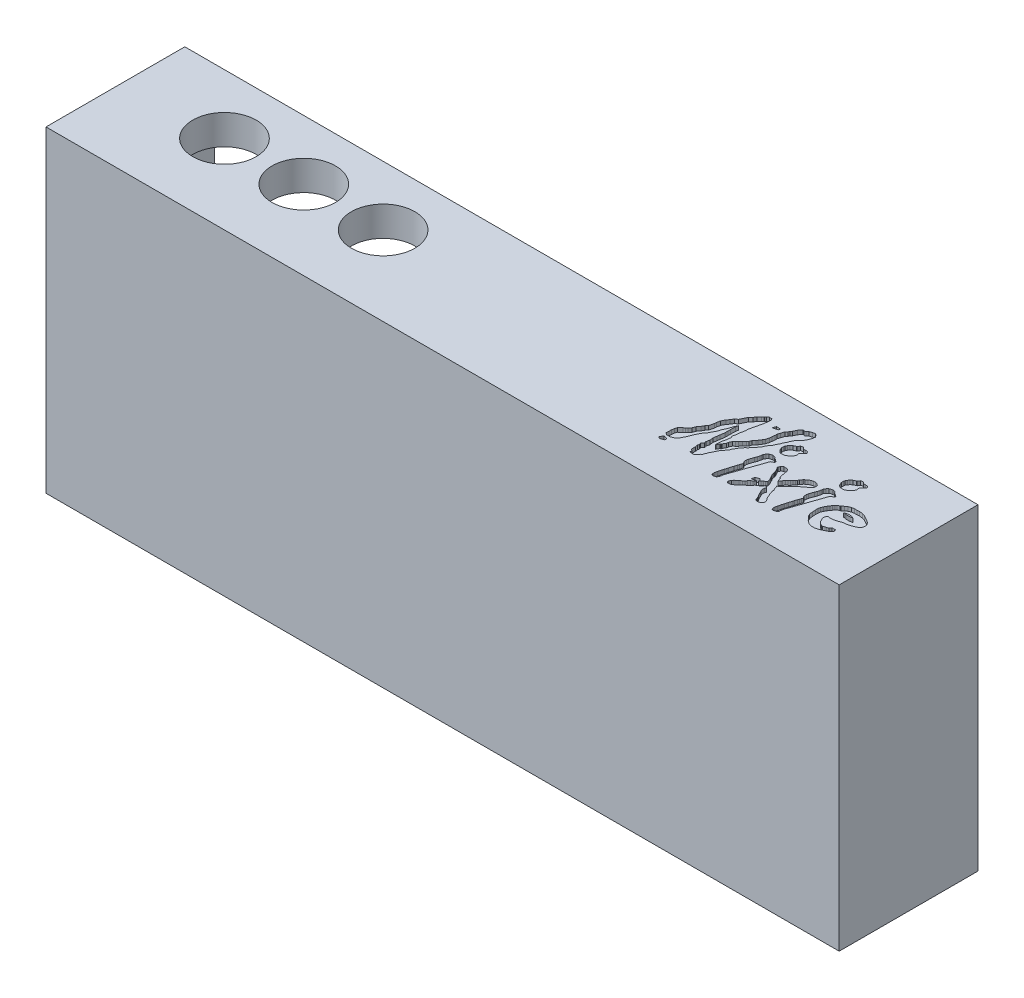
from build123d import *

# Parameters (mm, degrees)
CROQUIS1_W              = 200
CROQUIS1_H              = 80
SALIENTE_EXTRUIR1_DEPTH = 35
CROQUIS2_W              = 185
CROQUIS2_H              = 65
CORTAR_EXTRUIR1_DEPTH   = 27.5
CROQUIS3_R              = 8
CORTAR_EXTRUIR2_DEPTH   = 7.5
CROQUIS4_R              = 5.4
CORTAR_EXTRUIR3_DEPTH   = 7.5
CROQUIS5_R              = 2.50919292
CORTAR_EXTRUIR4_DEPTH   = 2
CORTAR_EXTRUIR5_START   = -1
CORTAR_EXTRUIR5_DEPTH   = 1


# Read off the part's stored shape, not the designer's step: Cortar-Extruir5
with BuildPart() as part:
    # Croquis1 → Saliente-Extruir1 (new body)
    with BuildSketch(Plane.XY):
        Rectangle(CROQUIS1_W, CROQUIS1_H)
    extrude(amount=SALIENTE_EXTRUIR1_DEPTH)

    # Croquis2 → Cortar-Extruir1 (cut)
    with BuildSketch(Plane(origin=(0, 0, 0), x_dir=(-1, 0, 0), z_dir=(0, 0, -1))):
        Rectangle(CROQUIS2_W, CROQUIS2_H)
    extrude(amount=-CORTAR_EXTRUIR1_DEPTH, mode=Mode.SUBTRACT)

    # Croquis3 → Cortar-Extruir2 (cut)
    with BuildSketch(Plane(origin=(0, 40, 0), x_dir=(1, 0, 0), z_dir=(0, 1, 0))):
        with Locations(Location((-75, -15, 0), (0, 0, 270))):
            Circle(CROQUIS3_R)
        with Locations(Location((-55, -15, 0), (0, 0, 270))):
            Circle(CROQUIS3_R)
        with Locations(Location((-35, -15, 0), (0, 0, 270))):
            Circle(CROQUIS3_R)
    extrude(amount=-CORTAR_EXTRUIR2_DEPTH, mode=Mode.SUBTRACT)

    # Croquis4 → Cortar-Extruir3 (cut)
    with BuildSketch(Plane.XZ.offset(40)):
        with Locations(Location((75, 17.5, 0), (0, 0, 270))):
            Circle(CROQUIS4_R)
    extrude(amount=-CORTAR_EXTRUIR3_DEPTH, mode=Mode.SUBTRACT)

    # Croquis5 → Cortar-Extruir4 (cut)
    with BuildSketch(Plane(origin=(0, 0, 0), x_dir=(-1, 0, 0), z_dir=(0, 0, -1))):
        with Locations((96.25, -36.25)):
            Circle(CROQUIS5_R)
        with Locations((96.25, 36.25)):
            Circle(CROQUIS5_R)
        with Locations((-96.25, 36.25)):
            Circle(CROQUIS5_R)
        with Locations((-96.25, -36.25)):
            Circle(CROQUIS5_R)
    extrude(amount=-CORTAR_EXTRUIR4_DEPTH, mode=Mode.SUBTRACT)

    # Cortar-Extruir5 outline → Cortar-Extruir5 (cut)
    # profile 1 of 9: a face of its own
    with BuildSketch(Plane(origin=(0, 40, 0), x_dir=(1, 0, 0), z_dir=(0, 1, 0)).offset(CORTAR_EXTRUIR5_START)):
        Polygon((58.493809805, -8.804859145), (58.555046378, -8.398073344), (57.535894854, -8.32808869), (57.247208156, -9.167904538), align=None)
    # profile 2 of 9: a face of its own
    with BuildSketch(Plane(origin=(0, 40, 0), x_dir=(1, 0, 0), z_dir=(0, 1, 0)).offset(CORTAR_EXTRUIR5_START)):
        Polygon((80.219670837, -16.389446025), (80.307151655, -16.135751654), (79.948480303, -15.864561119), (79.78664079, -15.785828384), (79.607305114, -15.606492708), (79.379854989, -15.606492708), (79.292374171, -15.4665234), (79.152404863, -15.221577111), (78.513794895, -15.046615476), (78.058894644, -15.155966497), (77.704597333, -15.287187724), (77.359048104, -15.663355239), (77.061613325, -16.127003572), (77.03974312, -16.511919169), (76.961010384, -16.835598194), (76.860407444, -17.347360976), (76.6417054, -17.832879514), (76.230545558, -19.022618632), (76.169308986, -19.394412106), (76.160560904, -20.033022074), (76.322400417, -20.295464527), (76.501736092, -20.422311712), (76.527980338, -20.579777184), (76.427377398, -20.872837923), (76.296156171, -21.288371806), (76.156186863, -21.664539321), (75.963729065, -22.246286758), (75.902492492, -22.491233047), (75.605057713, -23.418529712), (75.530699018, -23.737834696), (75.395103751, -24.140246457), (75.311996974, -24.442055277), (75.167653625, -24.857589161), (75.09329493, -25.312489412), (74.997066031, -25.588053987), (74.948951581, -25.894236848), (74.878966927, -26.169801424), (74.874592887, -26.567839143), (74.975195827, -26.944006659), (75.320745056, -27.083975967), (76.029339678, -26.891518168), (76.396759111, -26.467236203), (76.374888907, -26.20041971), (76.471117806, -25.924855134), (76.462369725, -25.623046314), (76.619835196, -25.168146063), (76.759804504, -24.765734302), (76.856033403, -24.494543768), (77.096605652, -23.790323187), (77.23657496, -23.387911426), (77.398414472, -22.919889053), (77.534009739, -22.530599415), (77.673979047, -22.128187654), (77.853314723, -21.603302749), (78.019528276, -21.122158252), (78.242604361, -20.479174244), (78.426314078, -19.954289339), (78.605649754, -19.429404433), (78.780611389, -18.935137814), (78.903084533, -18.576466463), (79.056175964, -18.139062375), (79.397351152, -17.150529137), (79.506702174, -16.826850112), (79.462961766, -16.839972235), (79.965976466, -16.586277864), align=None)
    # profile 3 of 9: a face of its own
    with BuildSketch(Plane(origin=(0, 40, 0), x_dir=(1, 0, 0), z_dir=(0, 1, 0)).offset(CORTAR_EXTRUIR5_START)):
        Polygon((64.490619847, -15.606492708), (64.263169721, -15.606492708), (64.175688904, -15.4665234), (64.035719596, -15.221577111), (63.397109628, -15.046615476), (62.942209376, -15.155966497), (62.587912066, -15.287187724), (62.242362836, -15.663355239), (61.944928057, -16.127003572), (61.923057852, -16.511919169), (61.844325117, -16.835598194), (61.743722176, -17.347360976), (61.525020133, -17.832879514), (61.11386029, -19.022618632), (61.052623718, -19.394412106), (61.043875636, -20.033022074), (61.205715149, -20.295464527), (61.385050825, -20.422311712), (61.41129507, -20.579777184), (61.31069213, -20.872837923), (61.179470903, -21.288371806), (61.039501595, -21.664539321), (60.847043797, -22.246286758), (60.785807225, -22.491233047), (60.488372445, -23.418529712), (60.41401375, -23.737834696), (60.278418483, -24.140246457), (60.195311706, -24.442055277), (60.050968357, -24.857589161), (59.976609662, -25.312489412), (59.880380763, -25.588053987), (59.832266314, -25.894236848), (59.76228166, -26.169801424), (59.757907619, -26.567839143), (59.858510559, -26.944006659), (60.204059788, -27.083975967), (60.91265441, -26.891518168), (61.280073844, -26.467236203), (61.258203639, -26.20041971), (61.354432538, -25.924855134), (61.345684457, -25.623046314), (61.503149928, -25.168146063), (61.643119236, -24.765734302), (61.739348136, -24.494543768), (61.979920384, -23.790323187), (62.119889692, -23.387911426), (62.281729204, -22.919889053), (62.417324471, -22.530599415), (62.557293779, -22.128187654), (62.736629455, -21.603302749), (62.902843009, -21.122158252), (63.125919093, -20.479174244), (63.30962881, -19.954289339), (63.488964486, -19.429404433), (63.663926121, -18.935137814), (63.786399266, -18.576466463), (63.939490696, -18.139062375), (64.280665885, -17.150529137), (64.390016906, -16.826850112), (64.346276498, -16.839972235), (64.849291198, -16.586277864), (65.102985569, -16.389446025), (65.190466387, -16.135751654), (64.831795035, -15.864561119), (64.669955523, -15.785828384), align=None)
    # profile 4 of 9: a face of its own
    with BuildSketch(Plane(origin=(0, 40, 0), x_dir=(1, 0, 0), z_dir=(0, 1, 0)).offset(CORTAR_EXTRUIR5_START)):
        Polygon((86.320892132, -23.890332292), (85.914672058, -24.074635844), (85.560374747, -24.144620498), (85.114222578, -24.284589806), (84.860528207, -24.284589806), (84.598085754, -24.148994539), (84.348765424, -23.995903108), (84.003216195, -23.777201064), (83.788888192, -23.449147999), (83.438964922, -22.801789949), (83.320865818, -22.534973455), (83.27712541, -22.268156962), (83.421468758, -21.686409526), (83.560077797, -21.497397201), (83.714529497, -21.485203645), (84.165055707, -21.542066177), (85.000497515, -21.51144789), (85.459771807, -21.393348787), (86.142122183, -21.183394825), (86.583900312, -20.995311067), (87.104411176, -20.881586004), (87.764891348, -20.829097514), (88.460363848, -20.627891633), (89.06835553, -20.413563631), (89.829438642, -20.05926632), (90.314957179, -19.578121823), (90.454926487, -19.166961981), (90.481170733, -18.633328994), (90.332453343, -18.305275928), (89.982530073, -17.867871841), (89.497011535, -17.51357453), (88.092944414, -16.713125049), (87.410594037, -16.51629321), (86.583900312, -16.41569027), (85.971534589, -16.450682597), (85.284810172, -16.446308556), (84.668070408, -16.538163414), (84.07757489, -16.800605867), (83.47833129, -17.189895505), (83.019056998, -17.618551511), (82.848469404, -17.640421715), (82.402317234, -17.937856495), (82.157370945, -18.156558538), (81.868684247, -18.537100095), (81.606241795, -18.86515316), (81.317555097, -19.350671698), (81.002624154, -19.919297012), (80.753303824, -20.50979253), (80.661448966, -20.986562985), (80.652700884, -21.647043158), (80.718311497, -22.395004147), (80.792670192, -23.326674854), (80.945761623, -23.466644162), (81.063860726, -23.790323187), (81.286936811, -24.083383926), (81.597493713, -24.345826378), (82.008653555, -24.813848752), (82.502920174, -25.211886472), (82.992812753, -25.50494721), (83.648918884, -25.658038641), (84.440620283, -25.684282886), (85.009245596, -25.539939537), (85.595367074, -25.321237494), (86.198984715, -25.032550796), (86.916327418, -24.682627526), (87.32311322, -24.428933155), (87.629296081, -24.157742621), (87.694906694, -23.724712574), (87.447987194, -23.727456124), (87.502448896, -23.444773958), (86.632014762, -23.444773958), align=None)
        Polygon((87.101961094, -18.656499031), (87.016930359, -18.672695362), (86.500793535, -18.782046384), (86.015274998, -18.808290629), (85.617237278, -18.803916588), (85.188581272, -18.685817484), (84.804902858, -18.688427542), (85.066108128, -18.572092422), (85.354794826, -18.488985645), (85.757206586, -18.405878868), (86.115877938, -18.405878868), (86.52703778, -18.445245236), (86.885709132, -18.56334434), align=None, mode=Mode.SUBTRACT)
    # profile 5 of 9: a face of its own
    with BuildSketch(Plane(origin=(0, 40, 0), x_dir=(1, 0, 0), z_dir=(0, 1, 0)).offset(CORTAR_EXTRUIR5_START)):
        Polygon((65.853107454, -9.896172031), (65.496649248, -9.447843154), (64.840543117, -9.548446094), (64.493197143, -10.122152365), (64.381268825, -10.138941613), (63.751406939, -10.432002351), (63.375239423, -10.760055417), (63.073430603, -11.136222932), (62.867850682, -11.52551257), (62.806614109, -11.897306045), (62.806614109, -12.360954378), (63.00781999, -12.824602711), (63.174033543, -13.161403858), (63.418979832, -13.401976106), (63.655178039, -13.611930068), (64.166940822, -13.646922395), (64.862413321, -13.594433905), (65.479153085, -13.192022144), (65.899061009, -12.815854629), (66.209617911, -12.391572664), (66.358335301, -11.962916658), (66.25335832, -11.62174147), (66.235862156, -11.499268325), (66.332091055, -11.219329709), (66.467686323, -11.088108483), (66.996945269, -10.672574599), (67.185029026, -10.370765779), (67.023189514, -9.907117446), (66.402075709, -9.837132792), (65.951549499, -9.872125119), align=None)
    # profile 6 of 9: a face of its own
    with BuildSketch(Plane(origin=(0, 40, 0), x_dir=(1, 0, 0), z_dir=(0, 1, 0)).offset(CORTAR_EXTRUIR5_START)):
        Polygon((64.665581482, -6.416632827), (64.796802708, -5.616183347), (64.525612174, -5.646801633), (64.538734296, -5.414977466), (64.035719596, -4.968825297), (63.362117301, -5.104420564), (62.688515006, -5.349366853), (62.286103245, -5.694916082), (62.006164629, -5.83051135), (61.599378828, -5.716786287), (60.978265023, -6.48224344), (60.56273114, -7.361425656), (60.256548279, -7.663234477), (60.11220493, -8.07876836), (59.749159537, -8.411195467), (59.491091125, -9.268507478), (59.268015041, -9.911491487), (59.268015041, -10.436376392), (59.198030387, -11.096856564), (59.119297651, -11.739840573), (58.891847525, -12.505297727), (58.611908909, -12.995190305), (58.209497149, -13.62067815), (57.964550859, -13.957479297), (57.479032322, -14.526104611), (57.299696646, -15.037867394), (56.958521458, -15.326554092), (56.459880798, -15.890805365), (56.061843078, -16.406942188), (55.676927481, -16.81372799), (55.278889762, -17.119910851), (54.933340532, -17.837253555), (54.854607797, -18.309649969), (54.42157775, -19.000748428), (54.417203709, -19.175710063), (54.198501665, -19.280687044), (53.857326477, -19.932419134), (53.764792063, -20.001819945), (53.782967782, -19.757457499), (53.848578395, -18.926389733), (53.887944763, -18.26590956), (54.128517011, -17.386727344), (54.207249747, -16.538163414), (54.02354003, -15.925797692), (54.246616115, -15.033493353), (54.303478646, -14.233043873), (54.439073913, -13.651296436), (54.539676853, -13.135159613), (54.517806649, -12.575282381), (54.719012529, -11.652359756), (55.208905108, -9.609682667), (55.348874416, -8.809233186), (55.42323311, -8.091890483), (55.488843724, -7.667608518), (55.265767639, -7.208334226), (54.583417262, -7.208334226), (54.167883379, -7.440158392), (53.966677499, -7.807577826), (53.800463945, -7.912554807), (53.568639779, -8.096264523), (52.916907688, -8.67801196), (52.597602704, -9.268507478), (51.989611023, -9.819636629), (51.180413461, -11.551756816), (50.585543901, -11.958542617), (50.139391732, -12.689007443), (49.723857849, -13.248884675), (49.247087393, -14.11931881), (49.054629595, -14.985378903), (49.050255554, -15.431531073), (48.73095057, -16.704376968), (48.311042646, -17.150529137), (47.978615539, -17.797887187), (47.43186043, -18.484611604), (47.125677568, -19.285061085), (46.675151358, -19.836190235), (46.38209062, -20.094258647), (46.014671186, -20.356701099), (45.292954441, -21.052173598), (45.083000479, -21.66016528), (45.004267744, -22.294401207), (44.98677158, -22.950507339), (44.93428309, -23.589117307), (45.450419913, -24.00465119), (46.390838701, -23.965284822), (47.274394958, -23.615361552), (47.878012599, -23.051110279), (47.895508763, -22.674942764), (48.223561828, -22.268156962), (48.866545837, -20.601647388), (49.312698007, -19.722465172), (49.710735726, -18.965756101), (50.13064365, -18.519603931), (50.603040065, -17.631673633), (51.119176888, -16.695628886), (51.272268319, -15.973912141), (51.687802202, -15.164714579), (52.260801557, -13.506953087), (52.339534293, -13.41947227), (52.518869969, -12.960197978), (52.413892988, -13.528823292), (52.392022783, -14.749180696), (52.396396824, -15.374668541), (52.378900661, -15.882057283), (52.383274702, -16.21885843), (52.221435189, -17.255506118), (52.133954372, -17.911612249), (51.993985064, -18.790794466), (52.094588004, -19.731213254), (51.897756164, -20.540410816), (52.033351431, -21.004059149), (51.556580976, -21.581432544), (51.718420488, -22.001340469), (51.600321385, -22.338141616), (51.735916652, -22.911140971), (51.709672407, -23.339796977), (51.731542611, -23.969658863), (52.173320739, -24.271467683), (52.133954372, -24.75261218), (52.606350786, -24.844467038), (53.297449245, -24.844467038), (53.953555376, -23.995903108), (54.329722891, -23.667850042), (54.360341178, -23.387911426), (54.609661507, -22.90676693), (54.740882734, -22.460614761), (55.077683881, -21.900737528), (55.305134007, -21.397722828), (55.646309195, -20.676006083), (56.026850751, -20.256098159), (56.713575169, -19.293809166), (56.901658927, -18.747054057), (57.133483093, -18.419000991), (57.522772731, -17.701658287), (57.933932573, -17.273002282), (58.143886535, -16.879338603), (58.493809805, -16.669384641), (60.077212603, -14.727310492), (60.357151219, -14.079952442), (60.724570652, -13.366983779), (61.175096863, -12.846472915), (61.402546988, -12.255977397), (61.769966422, -11.612993388), (61.883691484, -11.214955668), (62.299225368, -10.440750433), (62.482935084, -9.911491487), (62.880972804, -9.111042007), (63.117171012, -8.870469758), (63.738284816, -8.323714649), (64.013849391, -7.88193652), (64.040093636, -7.645738313), (64.324406293, -7.326433329), (64.481871765, -6.858410955), align=None)
    # profile 7 of 9: a face of its own
    with BuildSketch(Plane(origin=(0, 40, 0), x_dir=(1, 0, 0), z_dir=(0, 1, 0)).offset(CORTAR_EXTRUIR5_START)):
        Polygon((46.329602129, -25.329985575), (46.351472333, -24.770108343), (45.367313136, -24.564528422), (44.912412885, -25.391222148), (45.389183341, -25.684282886), align=None)
    # profile 8 of 9: a face of its own
    with BuildSketch(Plane(origin=(0, 40, 0), x_dir=(1, 0, 0), z_dir=(0, 1, 0)).offset(CORTAR_EXTRUIR5_START)):
        Polygon((80.969792721, -9.896172031), (80.613334516, -9.447843154), (79.957228385, -9.548446094), (79.609882411, -10.122152365), (79.497954093, -10.138941613), (78.868092206, -10.432002351), (78.491924691, -10.760055417), (78.190115871, -11.136222932), (77.984535949, -11.52551257), (77.923299377, -11.897306045), (77.923299377, -12.360954378), (78.124505257, -12.824602711), (78.290718811, -13.161403858), (78.5356651, -13.401976106), (78.771863307, -13.611930068), (79.28362609, -13.646922395), (79.979098589, -13.594433905), (80.595838352, -13.192022144), (81.015746277, -12.815854629), (81.326303179, -12.391572664), (81.475020569, -11.962916658), (81.370043588, -11.62174147), (81.352547424, -11.499268325), (81.448776323, -11.219329709), (81.58437159, -11.088108483), (82.113630536, -10.672574599), (82.301714294, -10.370765779), (82.139874782, -9.907117446), (81.518760977, -9.837132792), (81.068234767, -9.872125119), align=None)
    # profile 9 of 9: a face of its own
    with BuildSketch(Plane(origin=(0, 40, 0), x_dir=(1, 0, 0), z_dir=(0, 1, 0)).offset(CORTAR_EXTRUIR5_START)):
        Polygon((66.823687052, -22.715486031), (66.651396039, -22.880522685), (66.419571873, -23.147339178), (66.074022644, -23.431651835), (65.697855128, -23.80781935), (65.396046308, -24.201483029), (65.081115365, -24.477047604), (64.748688258, -24.726367934), (64.490619847, -24.993184428), (64.201933149, -25.176894145), (63.882628165, -25.417466393), (63.572071263, -25.780511786), (63.405857709, -26.143557178), (63.348995178, -26.436617917), (63.572071263, -26.804037351), (64.341902457, -26.75154886), (64.722444013, -26.515350653), (65.098611528, -26.257282241), (65.391672267, -25.990465748), (65.662862801, -25.776137745), (65.859694641, -25.614298232), (66.15712942, -25.246878799), (66.441442077, -25.050046959), (66.690762407, -24.813848752), (67.150036699, -24.40706295), (67.316250253, -24.183986866), (67.674921604, -23.816567432), (67.849883239, -23.698468329), (68.440378758, -23.35729314), (68.610966352, -23.116720892), (68.877782845, -22.985499666), (68.943393459, -22.749301458), (69.113786844, -22.504360967), (69.170843584, -22.70556105), (69.494522609, -22.85865248), (69.591764444, -22.938213982), (69.485774527, -23.309178691), (69.4507822, -23.694094288), (69.516392813, -24.175238784), (69.910056492, -24.870711283), (70.015033473, -25.120031613), (70.211865313, -25.487451047), (70.417445234, -25.741145418), (70.491803929, -26.016709993), (70.714880013, -26.296648609), (70.728002136, -26.541594898), (70.876719526, -26.874022005), (71.161032183, -27.083975967), (71.804016191, -27.083975967), (72.355145342, -26.729678656), (72.521358895, -26.484732367), (72.578221427, -26.213541832), (72.521358895, -25.920481094), (72.315778974, -25.588053987), (72.267664524, -25.439336597), (72.031466317, -25.20313839), (71.8477566, -24.901329569), (71.751527701, -24.638887117), (71.607184352, -24.284589806), (71.471589085, -24.00465119), (71.366612104, -23.750956819), (71.261635123, -23.344171018), (71.178528346, -23.142965137), (71.091047529, -23.020491993), (71.143536019, -22.613706191), (70.841727199, -22.150057858), (70.736750218, -21.75639418), (70.631773237, -21.437089196), (70.531170297, -21.345234337), (70.837353158, -21.135280375), (71.082299447, -20.855341759), (71.510955453, -20.614769511), (71.808390232, -20.295464527), (72.429504037, -19.503763128), (72.674450326, -19.285061085), (73.168716945, -18.847656997), (73.321808376, -18.751428098), (73.798578831, -18.379634623), (74.117883815, -18.178428743), (74.375952227, -17.946604576), (74.752119742, -17.640421715), (75.084546849, -17.452337957), (75.421347996, -17.137407014), (75.526324977, -16.91433093), (75.64005004, -16.673758681), (75.521950936, -16.043896795), (75.145783421, -15.711469689), (74.616524475, -15.610866749), (74.183494428, -15.606492708), (73.636739319, -15.746462016), (73.181839067, -15.991408305), (72.836289838, -16.284469044), (72.556351222, -16.459430679), (72.355145342, -16.756865458), (72.04458844, -17.080544483), (71.922115295, -17.434841794), (71.685917088, -17.719154451), (71.423474635, -18.038459435), (71.112917733, -18.401504828), (70.793612749, -18.703313648), (70.456811602, -19.005122468), (70.141880659, -19.385664025), (69.966919024, -19.648106477), (69.605714149, -20.001007791), (69.463904323, -19.582495864), (69.35017926, -19.101351368), (69.030874276, -18.983252264), (68.855912641, -18.410252909), (68.812172232, -18.003467108), (68.772805864, -17.736650614), (68.680951006, -17.395475426), (68.619714434, -17.207391668), (68.659080802, -16.949323257), (68.50161533, -16.573155741), (68.252295, -16.310713289), (67.705539891, -16.16636994), (67.246265599, -16.16636994), (66.760747061, -16.5687817), (66.559541181, -17.032430033), (66.633899876, -17.329864813), (66.830731715, -17.574811102), (67.088800127, -18.029711353), (67.180654985, -18.296527847), (67.30312813, -18.458367359), (67.281257926, -18.659573239), (67.386234907, -19.000748428), (67.499959969, -19.420656352), (67.683669686, -19.704969009), (67.749280299, -19.941167216), (68.059837202, -20.387319385), (68.296035409, -20.929700454), (68.418508553, -21.35835646), (68.121073774, -21.677661444), (67.80176879, -21.896363488), (67.478089765, -22.20692039), (67.136029209, -22.436173741), (67.250639639, -22.311897371), (66.839479797, -21.765142261), (65.90780909, -22.154431899), (65.732847455, -22.884896726), align=None)
    extrude(amount=CORTAR_EXTRUIR5_DEPTH, mode=Mode.SUBTRACT)


solid = part.part
